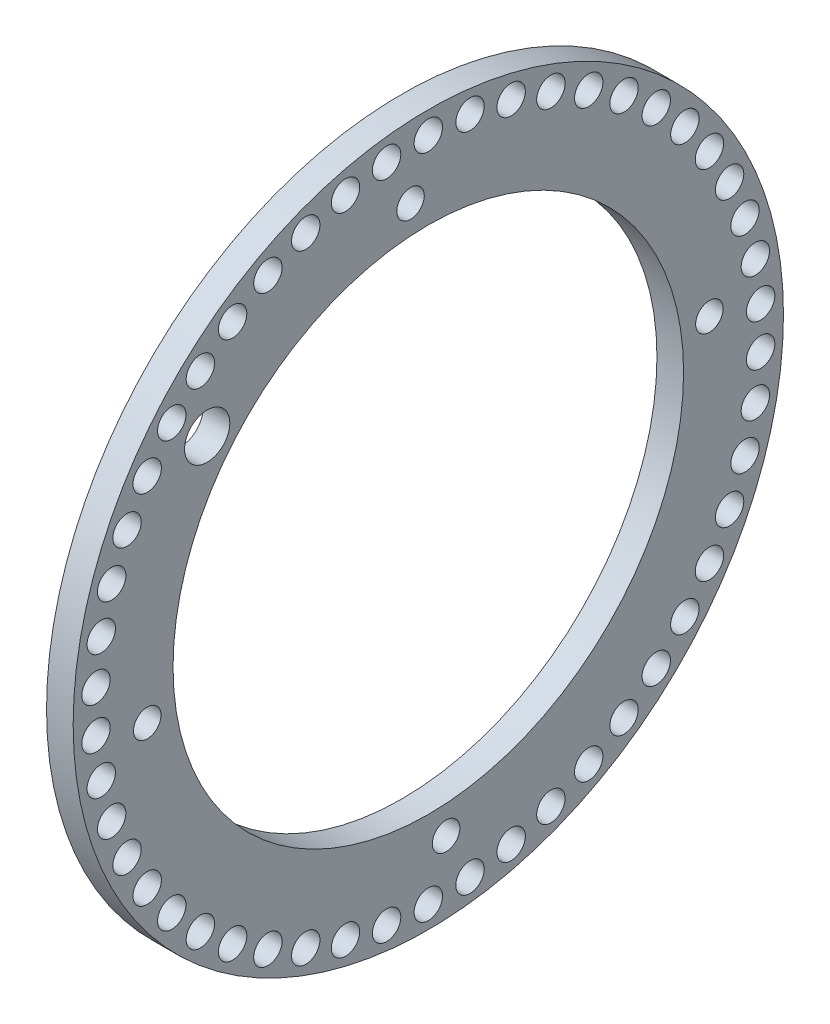
from build123d import *

# Parameters (mm, degrees)
SKETCH1_R           = 40
SKETCH1_R_2         = 1.6
SKETCH1_R_3         = 28.75
SKETCH1_R_4         = 1.55
SKETCH1_R_5         = 2.55
BOSS_EXTRUDE4_DEPTH = 3


with BuildPart() as part:
    # Sketch1 → Boss-Extrude4 (new body)
    with BuildSketch(Plane(origin=(0, 0, 0), x_dir=(0, 0, -1), z_dir=(1, 0, 0))):
        Circle(SKETCH1_R)
        with Locations((0, 37.5)):
            Circle(SKETCH1_R_2, mode=Mode.SUBTRACT)
        Circle(SKETCH1_R_3, mode=Mode.SUBTRACT)
        with Locations((4.699996259, 37.204301299)):
            Circle(SKETCH1_R_2, mode=Mode.SUBTRACT)
        with Locations((9.325870769, 36.321868542)):
            Circle(SKETCH1_R_2, mode=Mode.SUBTRACT)
        with Locations((13.804670726, 34.866618221)):
            Circle(SKETCH1_R_2, mode=Mode.SUBTRACT)
        with Locations((18.065762779, 32.861500502)):
            Circle(SKETCH1_R_2, mode=Mode.SUBTRACT)
        with Locations((22.041946961, 30.338137289)):
            Circle(SKETCH1_R_2, mode=Mode.SUBTRACT)
        with Locations((25.670516472, 27.336323528)):
            Circle(SKETCH1_R_2, mode=Mode.SUBTRACT)
        with Locations((28.894246604, 23.903399616)):
            Circle(SKETCH1_R_2, mode=Mode.SUBTRACT)
        with Locations((31.662297206, 20.093504812)):
            Circle(SKETCH1_R_2, mode=Mode.SUBTRACT)
        with Locations((33.931014467, 15.966723434)):
            Circle(SKETCH1_R_2, mode=Mode.SUBTRACT)
        with Locations((35.664619361, 11.588137289)):
            Circle(SKETCH1_R_2, mode=Mode.SUBTRACT)
        with Locations((36.835771902, 7.026799297)):
            Circle(SKETCH1_R_2, mode=Mode.SUBTRACT)
        with Locations((37.426002316, 2.354644482)):
            Circle(SKETCH1_R_2, mode=Mode.SUBTRACT)
        with Locations((37.426002316, -2.354644482)):
            Circle(SKETCH1_R_2, mode=Mode.SUBTRACT)
        with Locations((36.835771902, -7.026799297)):
            Circle(SKETCH1_R_2, mode=Mode.SUBTRACT)
        with Locations((35.664619361, -11.588137289)):
            Circle(SKETCH1_R_2, mode=Mode.SUBTRACT)
        with Locations((33.931014467, -15.966723434)):
            Circle(SKETCH1_R_2, mode=Mode.SUBTRACT)
        with Locations((31.662297206, -20.093504812)):
            Circle(SKETCH1_R_2, mode=Mode.SUBTRACT)
        with Locations((28.894246604, -23.903399616)):
            Circle(SKETCH1_R_2, mode=Mode.SUBTRACT)
        with Locations((25.670516472, -27.336323528)):
            Circle(SKETCH1_R_2, mode=Mode.SUBTRACT)
        with Locations((22.041946961, -30.338137289)):
            Circle(SKETCH1_R_2, mode=Mode.SUBTRACT)
        with Locations((18.065762779, -32.861500502)):
            Circle(SKETCH1_R_2, mode=Mode.SUBTRACT)
        with Locations((13.804670726, -34.866618221)):
            Circle(SKETCH1_R_2, mode=Mode.SUBTRACT)
        with Locations((9.325870769, -36.321868542)):
            Circle(SKETCH1_R_2, mode=Mode.SUBTRACT)
        with Locations((4.699996259, -37.204301299)):
            Circle(SKETCH1_R_2, mode=Mode.SUBTRACT)
        with Locations((0, -37.5)):
            Circle(SKETCH1_R_2, mode=Mode.SUBTRACT)
        with Locations((-4.699996259, -37.204301299)):
            Circle(SKETCH1_R_2, mode=Mode.SUBTRACT)
        with Locations((-9.325870769, -36.321868542)):
            Circle(SKETCH1_R_2, mode=Mode.SUBTRACT)
        with Locations((-13.804670726, -34.866618221)):
            Circle(SKETCH1_R_2, mode=Mode.SUBTRACT)
        with Locations((-18.065762779, -32.861500502)):
            Circle(SKETCH1_R_2, mode=Mode.SUBTRACT)
        with Locations((-22.041946961, -30.338137289)):
            Circle(SKETCH1_R_2, mode=Mode.SUBTRACT)
        with Locations((-25.670516472, -27.336323528)):
            Circle(SKETCH1_R_2, mode=Mode.SUBTRACT)
        with Locations((-28.894246604, -23.903399616)):
            Circle(SKETCH1_R_2, mode=Mode.SUBTRACT)
        with Locations((-31.662297206, -20.093504812)):
            Circle(SKETCH1_R_2, mode=Mode.SUBTRACT)
        with Locations((-33.931014467, -15.966723434)):
            Circle(SKETCH1_R_2, mode=Mode.SUBTRACT)
        with Locations((-35.664619361, -11.588137289)):
            Circle(SKETCH1_R_2, mode=Mode.SUBTRACT)
        with Locations((-36.835771902, -7.026799297)):
            Circle(SKETCH1_R_2, mode=Mode.SUBTRACT)
        with Locations((-37.426002316, -2.354644482)):
            Circle(SKETCH1_R_2, mode=Mode.SUBTRACT)
        with Locations((-37.426002316, 2.354644482)):
            Circle(SKETCH1_R_2, mode=Mode.SUBTRACT)
        with Locations((-36.835771902, 7.026799297)):
            Circle(SKETCH1_R_2, mode=Mode.SUBTRACT)
        with Locations((-35.664619361, 11.588137289)):
            Circle(SKETCH1_R_2, mode=Mode.SUBTRACT)
        with Locations((-33.931014467, 15.966723434)):
            Circle(SKETCH1_R_2, mode=Mode.SUBTRACT)
        with Locations((-31.662297206, 20.093504812)):
            Circle(SKETCH1_R_2, mode=Mode.SUBTRACT)
        with Locations((-28.894246604, 23.903399616)):
            Circle(SKETCH1_R_2, mode=Mode.SUBTRACT)
        with Locations((-25.670516472, 27.336323528)):
            Circle(SKETCH1_R_2, mode=Mode.SUBTRACT)
        with Locations((-22.041946961, 30.338137289)):
            Circle(SKETCH1_R_2, mode=Mode.SUBTRACT)
        with Locations((-18.065762779, 32.861500502)):
            Circle(SKETCH1_R_2, mode=Mode.SUBTRACT)
        with Locations((-13.804670726, 34.866618221)):
            Circle(SKETCH1_R_2, mode=Mode.SUBTRACT)
        with Locations((-9.325870769, 36.321868542)):
            Circle(SKETCH1_R_2, mode=Mode.SUBTRACT)
        with Locations((-4.699996259, 37.204301299)):
            Circle(SKETCH1_R_2, mode=Mode.SUBTRACT)
        with Locations((-2.003478367, 31.844376742)):
            Circle(SKETCH1_R_4, mode=Mode.SUBTRACT)
        with Locations((-31.655739691, -3.999049919)):
            Circle(SKETCH1_R_4, mode=Mode.SUBTRACT)
        with Locations((2.003478367, -31.844376742)):
            Circle(SKETCH1_R_4, mode=Mode.SUBTRACT)
        with Locations((31.655739691, 3.999049919)):
            Circle(SKETCH1_R_4, mode=Mode.SUBTRACT)
        with Locations((-24.906840573, 20.604730469)):
            Circle(SKETCH1_R_5, mode=Mode.SUBTRACT)
    extrude(amount=BOSS_EXTRUDE4_DEPTH)


solid = part.part
